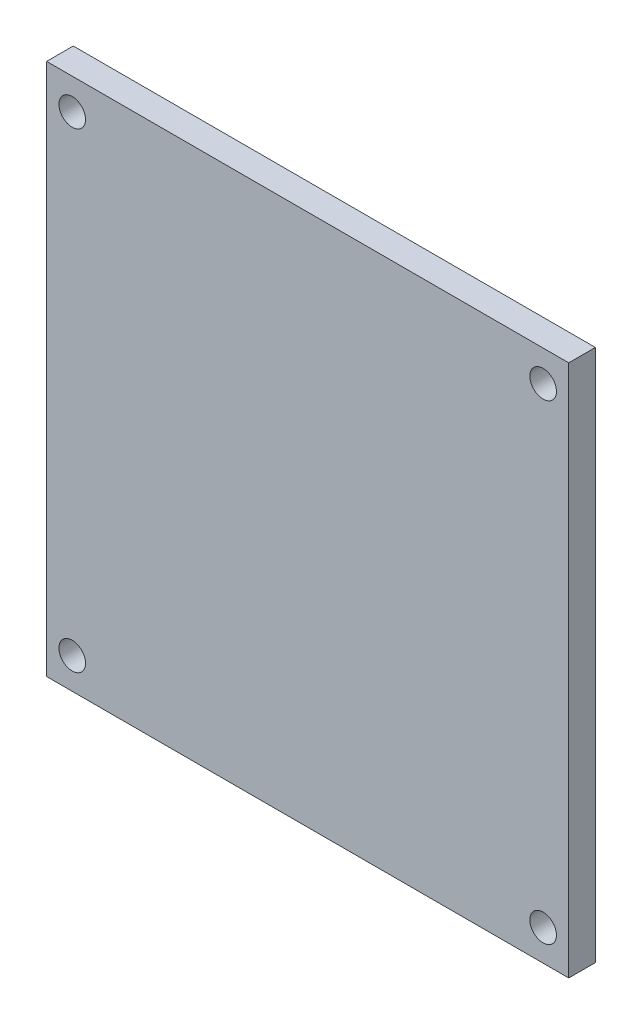
from build123d import *

# Parameters (mm, degrees)
SKETCH1_W           = 49.784
SKETCH1_H           = 50.8
BOSS_EXTRUDE1_DEPTH = 2.54
SKETCH3_R           = 1.27
CUT_EXTRUDE1_DEPTH  = 36.654218039


with BuildPart() as part:
    # Sketch1 → Boss-Extrude1 (new body)
    with BuildSketch(Plane.XY):
        Rectangle(SKETCH1_W, SKETCH1_H)
    extrude(amount=BOSS_EXTRUDE1_DEPTH)

    # Sketch3 → Cut-Extrude1 (cut, through all)
    with BuildSketch(Plane.XY.offset(2.54)):
        with Locations((22.450640303, -22.450640303)):
            Circle(SKETCH3_R)
        with Locations((22.450640303, 22.450640303)):
            Circle(SKETCH3_R)
        with Locations((-22.450640303, -22.450640303)):
            Circle(SKETCH3_R)
        with Locations((-22.450640303, 22.450640303)):
            Circle(SKETCH3_R)
    extrude(amount=-CUT_EXTRUDE1_DEPTH, mode=Mode.SUBTRACT)


solid = part.part
